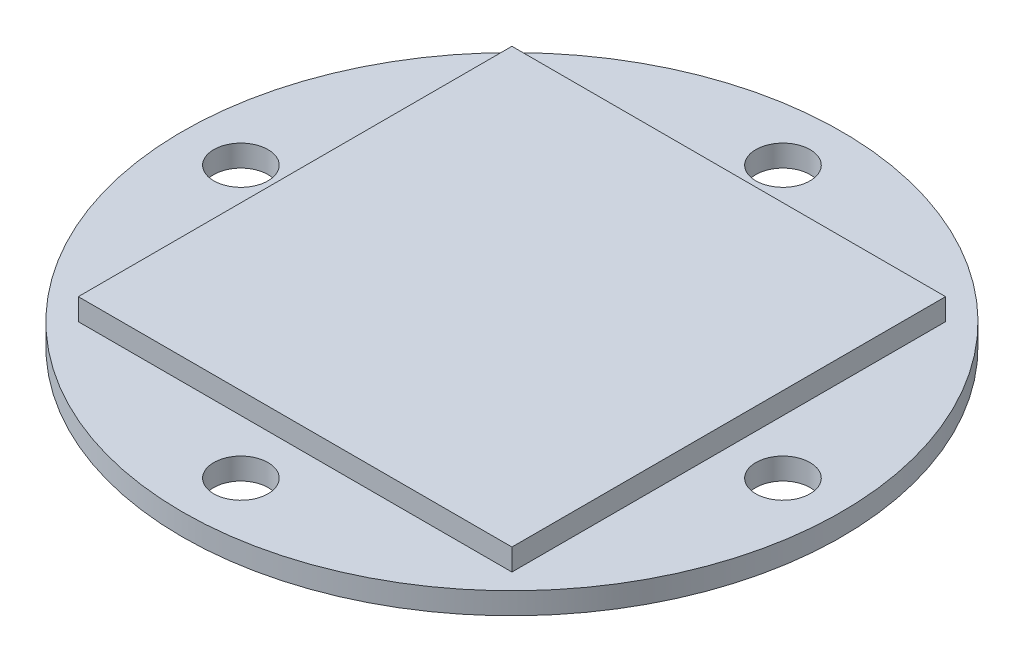
from build123d import *

# Parameters (mm, degrees)
SKETCH1_R           = 76
BOSS_EXTRUDE1_DEPTH = 5
SKETCH1_5_R         = 6.25
CUT_EXTRUDE2_DEPTH  = 5
SKETCH2_W           = 100
SKETCH2_H           = 100
BOSS_EXTRUDE2_DEPTH = 5
SKETCH3_W           = 15
SKETCH3_H           = 40
BOSS_EXTRUDE3_DEPTH = 35
FILLET3_R           = 20
SKETCH5_R           = 10
CUT_EXTRUDE3_DEPTH  = 72


with BuildPart() as part:
    # Sketch1 → Boss-Extrude1 (new body)
    with BuildSketch(Plane(origin=(0, 0, 0), x_dir=(1, 0, 0), z_dir=(0, 1, 0))):
        with Locations(Location((0, 0, 0), (0, 0, 270))):
            Circle(SKETCH1_R)
    extrude(amount=BOSS_EXTRUDE1_DEPTH)

    # Sketch1<5> → Cut-Extrude2 (cut)
    with BuildSketch(Plane(origin=(0, 0, 0), x_dir=(1, 0, 0), z_dir=(0, 1, 0))):
        with Locations(Location((-62.5, 0, 0), (0, 0, 270))):
            Circle(SKETCH1_5_R)
        with Locations(Location((0, 62.5, 0), (0, 0, 270))):
            Circle(SKETCH1_5_R)
        with Locations(Location((62.5, 0, 0), (0, 0, 270))):
            Circle(SKETCH1_5_R)
        with Locations(Location((0, -62.5, 0), (0, 0, 270))):
            Circle(SKETCH1_5_R)
    extrude(amount=CUT_EXTRUDE2_DEPTH, mode=Mode.SUBTRACT)

    # Sketch2 → Boss-Extrude2 (add)
    with BuildSketch(Plane(origin=(0, 5, 0), x_dir=(1, 0, 0), z_dir=(0, 1, 0))):
        Rectangle(SKETCH2_W, SKETCH2_H)
    extrude(amount=BOSS_EXTRUDE2_DEPTH)

    # Sketch3 → Boss-Extrude3 (add)
    with BuildSketch(Plane.XZ):
        with Locations((-15, 0)):
            Rectangle(SKETCH3_W, SKETCH3_H)
        with Locations((15, 0)):
            Rectangle(SKETCH3_W, SKETCH3_H)
    extrude(amount=BOSS_EXTRUDE3_DEPTH)

    # Fillet3
    fillet3_edges = [part.edges().sort_by_distance(p)[0] for p in [
        (15, -35, -20),
        (15, -35, 20),
        (-15, -35, 20),
        (-15, -35, -20),
    ]]
    fillet(fillet3_edges, radius=FILLET3_R - 0.0001)  # a hair under: the kernel refuses the full size

    # Sketch5 → Cut-Extrude3 (cut)
    with BuildSketch(Plane(origin=(22.5, 0, 0), x_dir=(0, 0, -1), z_dir=(1, 0, 0))):
        with Locations((0, -15)):
            Circle(SKETCH5_R)
    extrude(amount=-CUT_EXTRUDE3_DEPTH, mode=Mode.SUBTRACT)


solid = part.part
